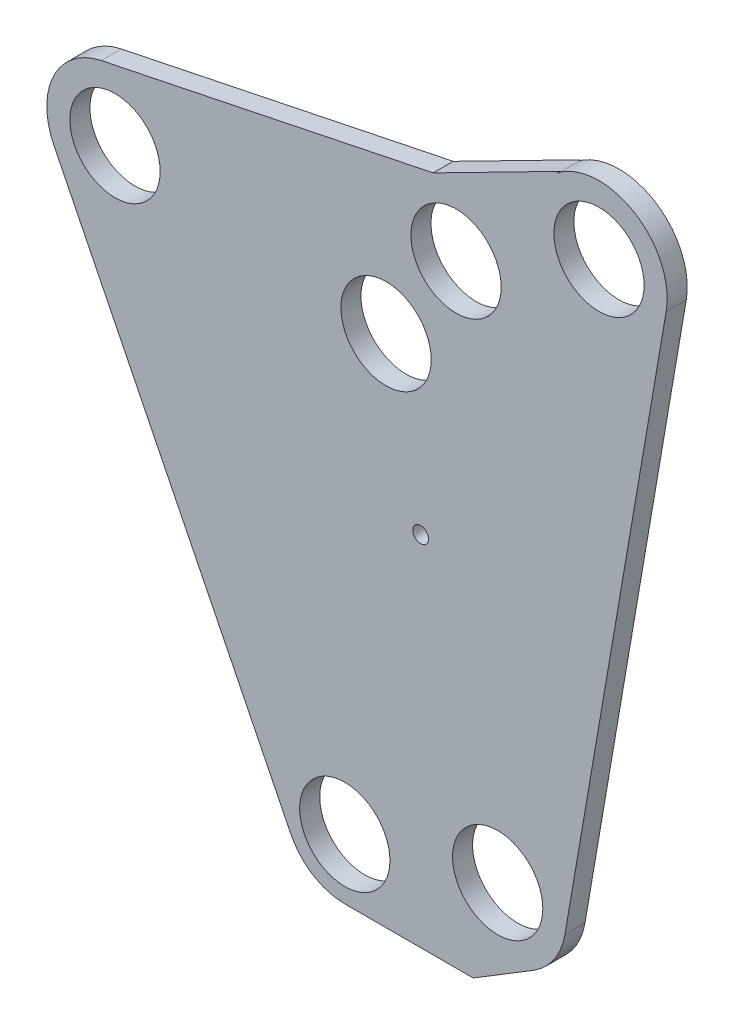
from build123d import *

# Parameters (mm, degrees)
SKETCH38_S_25_GCI_S_0001_2_R   = 14.2875
SKETCH38_S_25_GCI_S_0001_2_R_2 = 2.4892
BOSS_EXTRUDE1_DEPTH            = 6.35


with BuildPart() as part:
    # Sketch38-S-25-GCI-S-0001<2> → Boss-Extrude1 (new body)
    with BuildSketch(Plane.XY):
        with BuildLine():
            Line((-257.222320945, 168.623780627), (-182.209276961, 17.305639837))
            ThreePointArc((-182.209276961, 17.305639837), (-175.184275194, 9.578972497), (-165.14139135, 6.716714281))
            Line((-165.14139135, 6.716714281), (-124.50139135, 6.716714281))
            Line((-124.50139135, 6.716714281), (-105.504859769, 18.305753741))
            ThreePointArc((-105.504859769, 18.305753741), (-98.886879755, 24.609165774), (-95.469787431, 33.085848071))
            Line((-95.469787431, 33.085848071), (-63.40263524, 219.989195505))
            ThreePointArc((-63.40263524, 219.989195505), (-73.861400915, 242.322913981), (-98.437974994, 240.280178816))
            Line((-98.437974994, 240.280178816), (-96.609737, 241.791569578))
            Line((-96.609737, 241.791569578), (-137.151965965, 221.098173866))
            Line((-137.151965965, 221.098173866), (-242.25256855, 199.355314307))
            ThreePointArc((-242.25256855, 199.355314307), (-257.288410923, 187.667726863), (-257.222320945, 168.623780627))
        make_face()
        with Locations((-152.087803326, 169.552191595)):
            Circle(SKETCH38_S_25_GCI_S_0001_2_R, mode=Mode.SUBTRACT)
        with Locations((-129.928539211, 200.545368487)):
            Circle(SKETCH38_S_25_GCI_S_0001_2_R, mode=Mode.SUBTRACT)
        with Locations((-237.878717253, 178.212998331)):
            Circle(SKETCH38_S_25_GCI_S_0001_2_R, mode=Mode.SUBTRACT)
        with Locations((-84.681715591, 223.640063815)):
            Circle(SKETCH38_S_25_GCI_S_0001_2_R, mode=Mode.SUBTRACT)
        with Locations((-116.748867782, 36.736716381)):
            Circle(SKETCH38_S_25_GCI_S_0001_2_R, mode=Mode.SUBTRACT)
        with Locations((-165.14139135, 25.766714281)):
            Circle(SKETCH38_S_25_GCI_S_0001_2_R, mode=Mode.SUBTRACT)
        with Locations((-141.119951607, 119.950314325)):
            Circle(SKETCH38_S_25_GCI_S_0001_2_R_2, mode=Mode.SUBTRACT)
    extrude(amount=BOSS_EXTRUDE1_DEPTH)


solid = part.part
